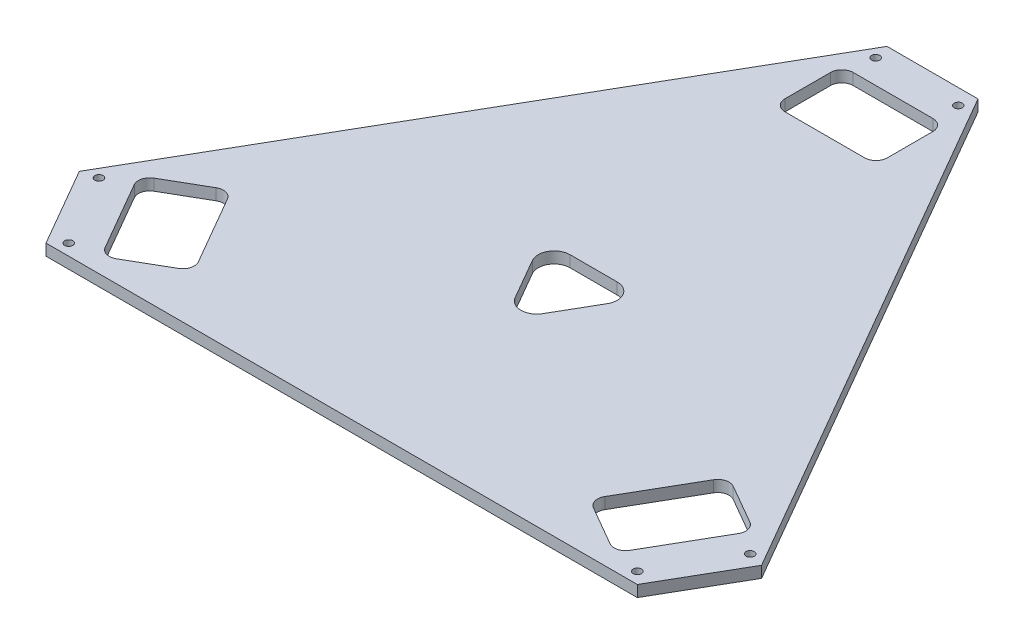
from build123d import *

# Parameters (mm, degrees)
BOSS_EXTRU_1_DEPTH      = 5
D_GAGEMENT_M31_D        = 3.6
ENL_V_MAT_EXTRU_2_DEPTH = 10


with BuildPart() as part:
    # Esquisse1 → Boss.-Extru.1 (new body)
    with BuildSketch(Plane(origin=(0, 0, 0), x_dir=(1, 0, 0), z_dir=(0, 1, 0))):
        Polygon((-20, -19.465788989), (-32.5, -41.116424083), (-137.5, -222.981758878), (-150, -244.632393973), (-130, -279.273410124), (-105, -279.273410124), (105, -279.273410124), (130, -279.273410124), (150, -244.632393973), (137.5, -222.981758878), (32.5, -41.116424083), (20, -19.465788989), align=None)
        with BuildLine():
            ThreePointArc((-108.52052658, -269.758981709), (-112.314621806, -270.258483822), (-115.350653599, -267.92885469))
            Line((-115.350653599, -267.92885469), (-132.850653599, -237.617965558))
            ThreePointArc((-132.850653599, -237.617965558), (-133.350155712, -233.823870332), (-131.02052658, -230.787838539))
            Line((-131.02052658, -230.787838539), (-113.700018505, -220.787838539))
            ThreePointArc((-113.700018505, -220.787838539), (-109.905923279, -220.288336426), (-106.869891486, -222.617965558))
            Line((-106.869891486, -222.617965558), (-89.369891486, -252.92885469))
            ThreePointArc((-89.369891486, -252.92885469), (-88.870389373, -256.722949916), (-91.200018505, -259.758981709))
            Line((-91.200018505, -259.758981709), (-108.52052658, -269.758981709))
        make_face(mode=Mode.SUBTRACT)
        with BuildLine():
            ThreePointArc((91.200018505, -259.758981709), (88.870389373, -256.722949916), (89.369891486, -252.92885469))
            Line((89.369891486, -252.92885469), (106.869891486, -222.617965558))
            ThreePointArc((106.869891486, -222.617965558), (109.905923279, -220.288336426), (113.700018505, -220.787838539))
            Line((113.700018505, -220.787838539), (131.02052658, -230.787838539))
            ThreePointArc((131.02052658, -230.787838539), (133.350155712, -233.823870332), (132.850653599, -237.617965558))
            Line((132.850653599, -237.617965558), (115.350653599, -267.92885469))
            ThreePointArc((115.350653599, -267.92885469), (112.314621806, -270.258483822), (108.52052658, -269.758981709))
            Line((108.52052658, -269.758981709), (91.200018505, -259.758981709))
        make_face(mode=Mode.SUBTRACT)
        with BuildLine():
            Line((17.5, -66.824772837), (-17.5, -66.824772837))
            ThreePointArc((-17.5, -66.824772837), (-21.035533906, -65.360306743), (-22.5, -61.824772837))
            Line((-22.5, -61.824772837), (-22.5, -41.824772837))
            ThreePointArc((-22.5, -41.824772837), (-21.035533906, -38.289238931), (-17.5, -36.824772837))
            Line((-17.5, -36.824772837), (17.5, -36.824772837))
            ThreePointArc((17.5, -36.824772837), (21.035533906, -38.289238931), (22.5, -41.824772837))
            Line((22.5, -41.824772837), (22.5, -61.824772837))
            ThreePointArc((22.5, -61.824772837), (21.035533906, -65.360306743), (17.5, -66.824772837))
        make_face(mode=Mode.SUBTRACT)
    extrude(amount=BOSS_EXTRU_1_DEPTH)

    # Dégagement M31 (through all)
    with Locations(Plane(origin=(-143.169872981, 5, 242.802266954), x_dir=(0, 0, 1), z_dir=(0, 1, 0))):
        with Locations((0, 0), (31.47114317, 18.169872981), (31.47114317, 268.169872981), (0, 286.339745962), (-216.506350946, 125), (-216.506350946, 161.339745962)):
            Hole(D_GAGEMENT_M31_D / 2)

    # Esquisse6 → Enlèv. mat.-Extru.2 (cut)
    with BuildSketch(Plane(origin=(0, 0, 0), x_dir=(-1, 0, 0), z_dir=(0, -1, 0))):
        with BuildLine():
            Line((-16.437822174, -178.975407932), (-6.062177826, -196.946551102))
            ThreePointArc((-6.062177826, -196.946551102), (0, -200.446551102), (6.062177826, -196.946551102))
            Line((6.062177826, -196.946551102), (16.437822174, -178.975407932))
            ThreePointArc((16.437822174, -178.975407932), (16.437822174, -171.975407932), (10.375644347, -168.475407932))
            Line((10.375644347, -168.475407932), (-10.375644347, -168.475407932))
            ThreePointArc((-10.375644347, -168.475407932), (-16.437822174, -171.975407932), (-16.437822174, -178.975407932))
        make_face()
    extrude(amount=-ENL_V_MAT_EXTRU_2_DEPTH, mode=Mode.SUBTRACT)


solid = part.part
